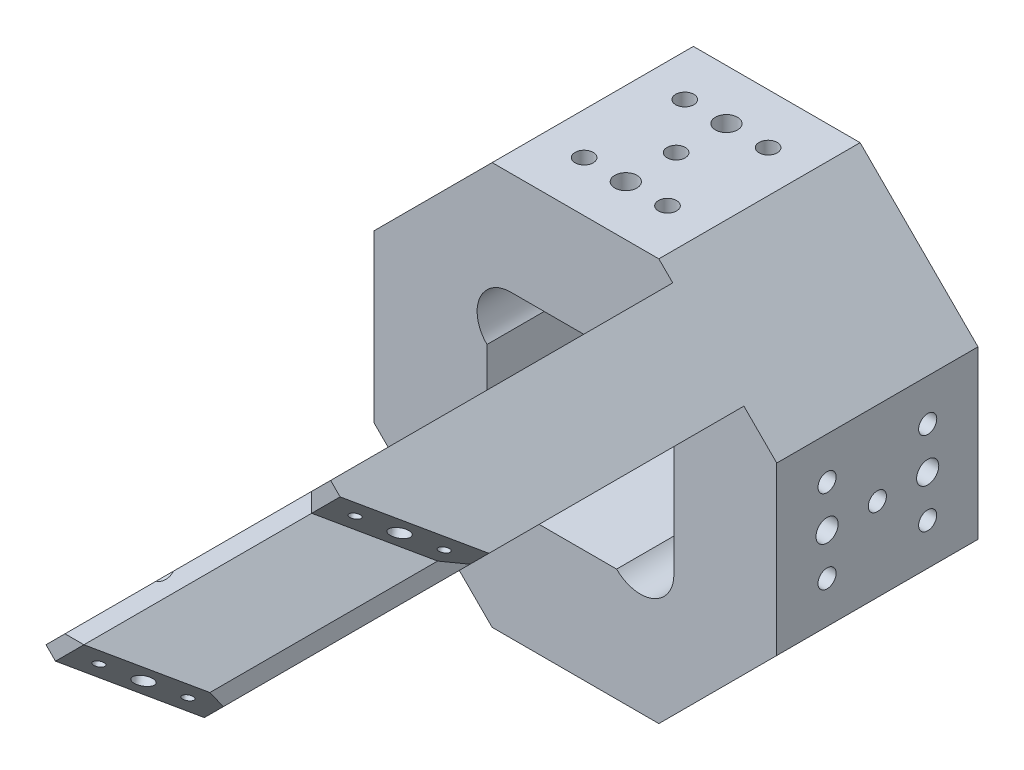
from build123d import *

# Parameters (mm, degrees)
SKETCH1_W                 = 26.4
SKETCH1_H                 = 26.4
BOSS_EXTRUDE1_DEPTH       = 30
BOSS_EXTRUDE2_DEPTH       = 53
CUT_EXTRUDE1_DEPTH        = 111.157089705
F_6_32_TAPPED_HOLE1_D     = 2.7051
F_1_72_TAPPED_HOLE1_D     = 1.5113
CHAMFER1_SIZE             = 2
M4X0_7_TAPPED_HOLE1_D     = 3.3
M4X0_7_TAPPED_HOLE1_DEPTH = 10.1
M4X0_7_TAPPED_HOLE1_TIP   = 0.991420021
M4X0_7_TAPPED_HOLE2_D     = 3.3
M4X0_7_TAPPED_HOLE2_DEPTH = 10.1
M4X0_7_TAPPED_HOLE2_TIP   = 0.991420021
M4X0_7_TAPPED_HOLE3_D     = 3.3
M4X0_7_TAPPED_HOLE3_DEPTH = 10.1
M4X0_7_TAPPED_HOLE3_TIP   = 0.991420021
CUT_EXTRUDE2_DEPTH        = 111.157089705
M4X0_7_TAPPED_HOLE4_D     = 3.3
M4X0_7_TAPPED_HOLE4_DEPTH = 10.1
M4X0_7_TAPPED_HOLE4_TIP   = 0.991420021
SKETCH24_R                = 5
CUT_EXTRUDE3_DEPTH        = 92.438503925
SKETCH25_W                = 19.328932188
SKETCH25_H                = 1.464466094
SKETCH25_W_2              = 1.464466094
SKETCH25_H_2              = 19.328932188
CUT_EXTRUDE4_DEPTH        = 92.438503925
F_6_32_TAPPED_HOLE2_D     = 2.7051
F_6_32_TAPPED_HOLE2_DEPTH = 15.335533906
F_6_32_TAPPED_HOLE3_D     = 2.7051
F_6_32_TAPPED_HOLE3_DEPTH = 15.335533906
M4X0_7_TAPPED_HOLE6_D     = 3.3
M4X0_7_TAPPED_HOLE6_DEPTH = 10.1
M4X0_7_TAPPED_HOLE6_TIP   = 0.991420021


with BuildPart() as part:
    # Sketch1 → Boss-Extrude1 (new body)
    with BuildSketch(Plane.XY):
        Polygon((-12.426406871, -30), (12.426406871, -30), (30, -12.426406871), (30, 12.426406871), (12.426406871, 30), (-12.426406871, 30), (-30, 12.426406871), (-30, -12.426406871), align=None)
        Rectangle(SKETCH1_W, SKETCH1_H, mode=Mode.SUBTRACT)
    extrude(amount=BOSS_EXTRUDE1_DEPTH)

    # Sketch2 → Boss-Extrude2 (add)
    with BuildSketch(Plane.XY.offset(30)):
        Polygon((14.495689014, 27.930717857), (25.102290732, 17.324116139), (20.859650045, 13.081475452), (10.253048327, 23.68807717), align=None)
        Polygon((-27.930717857, -14.495689014), (-17.324116139, -25.102290732), (-13.081475452, -20.859650045), (-23.68807717, -10.253048327), align=None)
    extrude(amount=BOSS_EXTRUDE2_DEPTH)

    # Sketch3 → Cut-Extrude1 (cut, through all)
    with BuildSketch(Plane(origin=(21.213203436, 21.213203436, 0), x_dir=(0, 0, -1), z_dir=(0.7071067811865475, 0.7071067811865477, 0))):
        Polygon((-83, 9.5), (-83, -5.5), (-68, -5.5), align=None)
    extrude(amount=-CUT_EXTRUDE1_DEPTH, mode=Mode.SUBTRACT)

    # #6-32 Tapped Hole1 (through all)
    with Locations(Plane(origin=(26.736174209, -26.736174209, 37.810660172), x_dir=(0.8660254037844379, 0.2886751345948145, -0.40824829046386363), z_dir=(0.5000000000000013, -0.5000000000000009, 0.7071067811865459))):
        with Locations((-8.826867068, 59.248446925), (-52.917682438, 28.071532389)):
            Hole(F_6_32_TAPPED_HOLE1_D / 2)

    # #1-72 Tapped Hole1 (through all)
    with Locations(Plane(origin=(25.986174209, -25.986174209, 36.75), x_dir=(0.8660254037844379, 0.2886751345948144, -0.40824829046386346), z_dir=(0.5000000000000012, -0.5000000000000009, 0.707106781186546))):
        with Locations((-12.002293548, 63.73917812), (-5.651440587, 54.75771573), (-56.093108918, 32.562263584), (-49.742255957, 23.580801194)):
            Hole(F_1_72_TAPPED_HOLE1_D / 2)

    # Chamfer1
    # the kernel refuses this chamfer: 2 mm, written as the material it takes off along each edge
    with BuildSketch(Plane(origin=(10.253048327, 23.68807717, 30), x_dir=(0.6873969152646597, 0.7262819568766873, 0), z_dir=(0, 0, 1))) as chamfer1_piece_1:
        Polygon((CHAMFER1_SIZE * 0.999621916911, -CHAMFER1_SIZE * 0.0274958766106), (-CHAMFER1_SIZE * 0.0274958766106, -CHAMFER1_SIZE * 0.999621916911), (0, 0), align=None)
    extrude(amount=58.143365976, mode=Mode.SUBTRACT)
    with BuildSketch(Plane(origin=(20.859650045, 13.081475452, 30), x_dir=(-0.7262819568766877, 0.6873969152646593, 0), z_dir=(0, 0, 1)), Plane(origin=(-13.081475452, -20.859650045, 30), x_dir=(-0.6873969152646596, -0.7262819568766873, 0), z_dir=(0, 0, 1))) as chamfer1_piece_2:
        Polygon((CHAMFER1_SIZE * 0.999621916911, -CHAMFER1_SIZE * 0.0274958766106), (-CHAMFER1_SIZE * 0.0274958766106, -CHAMFER1_SIZE * 0.999621916911), (0, 0), align=None)
    extrude(amount=43.143365976, mode=Mode.SUBTRACT)
    with BuildSketch(Plane(origin=(-23.68807717, -10.253048327, 30), x_dir=(-0.7262819568766861, -0.6873969152646611, 0), z_dir=(0, 0, 1))) as chamfer1_piece_3:
        Polygon((CHAMFER1_SIZE * 0.999621916911, CHAMFER1_SIZE * 0.0274958766106), (-CHAMFER1_SIZE * 0.0274958766106, CHAMFER1_SIZE * 0.999621916911), (0, 0), align=None)
    extrude(amount=58.143365976, mode=Mode.SUBTRACT)

    # M4x0.7 Tapped Hole1
    with Locations(Plane.ZY.offset(30)):
        with Locations((7.5, 0), (22.5, 0)):
            Hole(M4X0_7_TAPPED_HOLE1_D / 2, depth=M4X0_7_TAPPED_HOLE1_DEPTH)
            with Locations((0, 0, -(M4X0_7_TAPPED_HOLE1_DEPTH + M4X0_7_TAPPED_HOLE1_TIP / 2))):  # 118° drill point
                Cone(0, M4X0_7_TAPPED_HOLE1_D / 2, M4X0_7_TAPPED_HOLE1_TIP, mode=Mode.SUBTRACT)

    # M4x0.7 Tapped Hole2
    with Locations(Plane(origin=(0, -30, 0), x_dir=(-1, 0, 0), z_dir=(0, -1, 0))):
        with Locations((0, -22.5), (0, -7.5)):
            Hole(M4X0_7_TAPPED_HOLE2_D / 2, depth=M4X0_7_TAPPED_HOLE2_DEPTH)
            with Locations((0, 0, -(M4X0_7_TAPPED_HOLE2_DEPTH + M4X0_7_TAPPED_HOLE2_TIP / 2))):  # 118° drill point
                Cone(0, M4X0_7_TAPPED_HOLE2_D / 2, M4X0_7_TAPPED_HOLE2_TIP, mode=Mode.SUBTRACT)

    # M4x0.7 Tapped Hole3
    with Locations(Plane(origin=(21.213203436, -21.213203436, 0), x_dir=(0, 0, -1), z_dir=(0.7071067811865476, -0.7071067811865475, 0))):
        with Locations((-22.5, 0), (-7.5, 0)):
            Hole(M4X0_7_TAPPED_HOLE3_D / 2, depth=M4X0_7_TAPPED_HOLE3_DEPTH)
            with Locations((0, 0, -(M4X0_7_TAPPED_HOLE3_DEPTH + M4X0_7_TAPPED_HOLE3_TIP / 2))):  # 118° drill point
                Cone(0, M4X0_7_TAPPED_HOLE3_D / 2, M4X0_7_TAPPED_HOLE3_TIP, mode=Mode.SUBTRACT)

    # Sketch20 → Cut-Extrude2 (cut, through all)
    with BuildSketch(Plane(origin=(21.213203436, 21.213203436, 0), x_dir=(0, 0, -1), z_dir=(0.7071067811865475, 0.7071067811865477, 0))):
        Polygon((-83, 9.5), (-81, 9.5), (-81, 7.5), align=None)
    extrude(amount=-CUT_EXTRUDE2_DEPTH, mode=Mode.SUBTRACT)

    # M4x0.7 Tapped Hole4
    with Locations(Plane(origin=(0, 30, 0), x_dir=(1, 0, 0), z_dir=(0, 1, 0))):
        with Locations((0, -7.5), (0, -22.5)):
            Hole(M4X0_7_TAPPED_HOLE4_D / 2, depth=M4X0_7_TAPPED_HOLE4_DEPTH)
            with Locations((0, 0, -(M4X0_7_TAPPED_HOLE4_DEPTH + M4X0_7_TAPPED_HOLE4_TIP / 2))):  # 118° drill point
                Cone(0, M4X0_7_TAPPED_HOLE4_D / 2, M4X0_7_TAPPED_HOLE4_TIP, mode=Mode.SUBTRACT)

    # Sketch24 → Cut-Extrude3 (cut, through all)
    with BuildSketch(Plane(origin=(0, 0, 0), x_dir=(-1, 0, 0), z_dir=(0, 0, -1))):
        with Locations((-9.664466094, 9.664466094)):
            Circle(SKETCH24_R)
        with Locations((9.664466094, 9.664466094)):
            Circle(SKETCH24_R)
        with Locations((9.664466094, -9.664466094)):
            Circle(SKETCH24_R)
        with Locations((-9.664466094, -9.664466094)):
            Circle(SKETCH24_R)
    extrude(amount=-CUT_EXTRUDE3_DEPTH, mode=Mode.SUBTRACT)

    # Sketch25 → Cut-Extrude4 (cut, through all)
    with BuildSketch(Plane(origin=(0, 0, 0), x_dir=(-1, 0, 0), z_dir=(0, 0, -1))):
        with Locations((0, 13.932233047)):
            Rectangle(SKETCH25_W, SKETCH25_H)
        with Locations((-13.932233047, 0)):
            Rectangle(SKETCH25_W_2, SKETCH25_H_2)
    extrude(amount=-CUT_EXTRUDE4_DEPTH, mode=Mode.SUBTRACT)

    # #6-32 Tapped Hole2
    with Locations(Plane(origin=(0, 30, 0), x_dir=(1, 0, 0), z_dir=(0, 1, 0))):
        with Locations((0, -15), (-6.213203436, -7.5), (6.213203436, -7.5), (-6.213203436, -22.5), (6.213203436, -22.5)):
            Hole(F_6_32_TAPPED_HOLE2_D / 2, depth=F_6_32_TAPPED_HOLE2_DEPTH)

    # #6-32 Tapped Hole3
    with Locations(Plane(origin=(30, 0, 0), x_dir=(0, 0, -1), z_dir=(1, 0, 0))):
        with Locations((-15, 0), (-7.5, 6.213203436), (-22.5, -6.213203436), (-22.5, 6.213203436), (-7.5, -6.213203436)):
            Hole(F_6_32_TAPPED_HOLE3_D / 2, depth=F_6_32_TAPPED_HOLE3_DEPTH)

    # M4x0.7 Tapped Hole6
    with Locations(Plane(origin=(30, 0, 0), x_dir=(0, 0, -1), z_dir=(1, 0, 0))):
        with Locations((-22.5, 0), (-7.5, 0)):
            Hole(M4X0_7_TAPPED_HOLE6_D / 2, depth=M4X0_7_TAPPED_HOLE6_DEPTH)
            with Locations((0, 0, -(M4X0_7_TAPPED_HOLE6_DEPTH + M4X0_7_TAPPED_HOLE6_TIP / 2))):  # 118° drill point
                Cone(0, M4X0_7_TAPPED_HOLE6_D / 2, M4X0_7_TAPPED_HOLE6_TIP, mode=Mode.SUBTRACT)


solid = part.part
